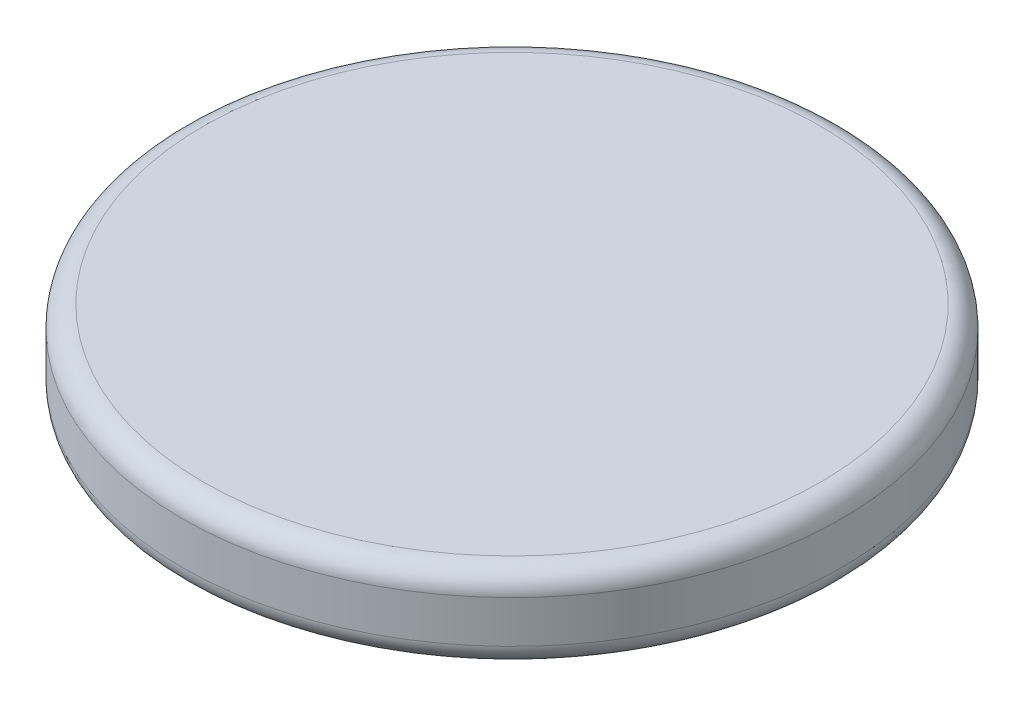
from build123d import *

# Parameters (mm, degrees)
SKETCH1_R           = 49.53
BOSS_EXTRUDE1_DEPTH = 12.7
FILLET1_R           = 3.175


with BuildPart() as part:
    # Sketch1 → Boss-Extrude1 (new body)
    with BuildSketch(Plane(origin=(0, 0, 0), x_dir=(1, 0, 0), z_dir=(0, 1, 0))):
        Circle(SKETCH1_R)
    extrude(amount=BOSS_EXTRUDE1_DEPTH)

    # Fillet1
    fillet1_edges = [part.edges().sort_by_distance(p)[0] for p in [
        (-49.53, 0, 0),
        (-49.53, 12.7, 0),
    ]]
    fillet(fillet1_edges, radius=FILLET1_R)


solid = part.part
